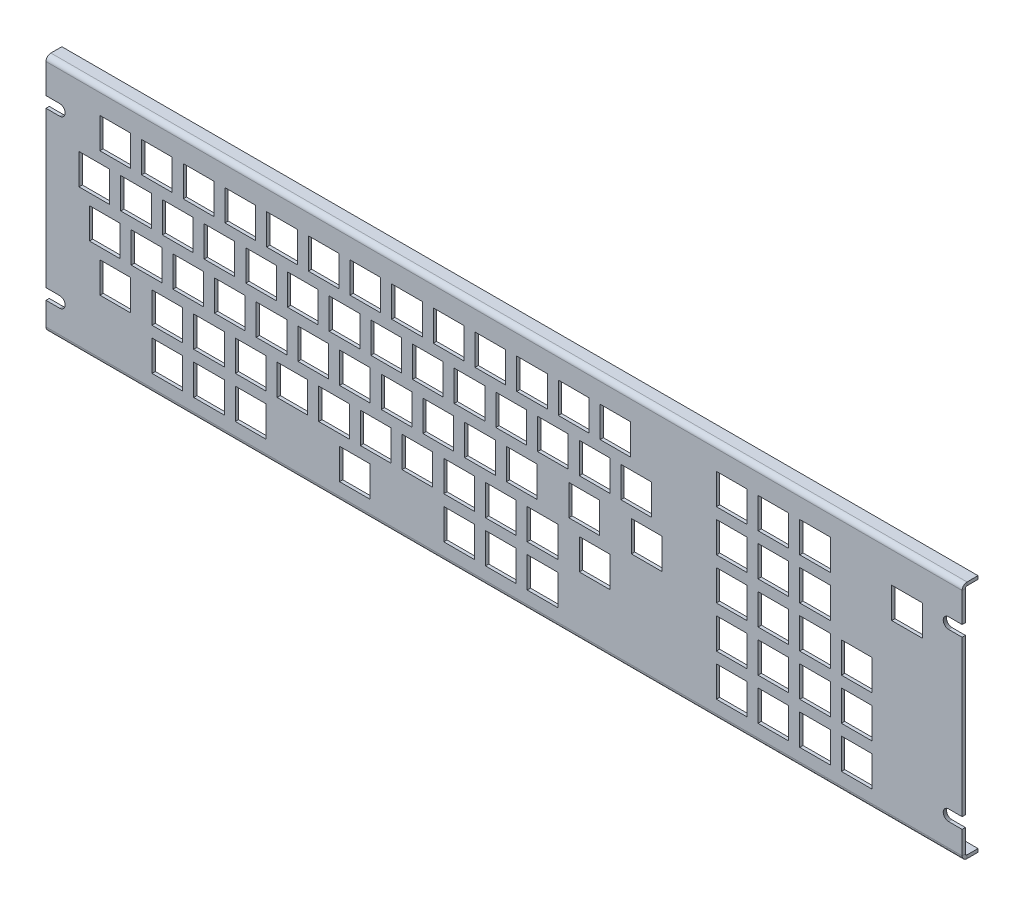
from build123d import *

# Parameters (mm, degrees)
MODEL_R                = 2
MODEL_W                = 14
MODEL_H                = 14
BASE_FLANGE1_DEPTH     = 1.5
SKETCHED_START         = -13.87500635
SKETCHED_BEND1_DEPTH   = 418.67500635
SKETCHED_BEND1_2_DEPTH = 418.67500635
SKETCH12_R             = 2
BOSS_EXTRUDE4_DEPTH    = 1.5
SKETCH14_W             = 14
SKETCH14_H             = 14
CUT_EXTRUDE2_DEPTH     = 422.757241927


# Read off the part's stored shape, not the designer's step: Sketched Bend1
# Sheet-metal steps are written as plain solids
with BuildPart() as part:
    # Model → Base-Flange1 (new body)
    with BuildSketch(Plane.XY):
        Polygon((404.8, -10), (404.8, -24.5), (398.662814326, -24.5), (398.591424199, -24.501019518), (398.520092298, -24.50407724), (398.448876804, -24.509170673), (398.377835801, -24.516295662), (398.30702723, -24.525446395), (398.236508844, -24.53661541), (398.166338159, -24.549793597), (398.096572407, -24.564970208), (398.02726849, -24.582132863), (397.958482934, -24.601267566), (397.89027184, -24.622358709), (397.822690843, -24.645389091), (397.755795062, -24.670339927), (397.68963906, -24.697190867), (397.624276793, -24.725920012), (397.559761573, -24.756503928), (397.496146018, -24.788917673), (397.433482014, -24.823134807), (397.371820672, -24.859127424), (397.311212282, -24.896866168), (397.251706278, -24.936320258), (397.193351195, -24.977457514), (397.136194627, -25.020244385), (397.080283191, -25.064645973), (397.025662491, -25.110626064), (396.972377075, -25.158147155), (396.920470404, -25.207170488), (396.869984814, -25.257656078), (396.820961481, -25.309562749), (396.77344039, -25.362848165), (396.727460299, -25.417468865), (396.683058711, -25.473380301), (396.64027184, -25.530536869), (396.599134583, -25.588891953), (396.559680494, -25.648397956), (396.52194175, -25.709006346), (396.485949133, -25.770667688), (396.451731998, -25.833331692), (396.419318254, -25.896947247), (396.388734337, -25.961462467), (396.360005193, -26.026824734), (396.333154253, -26.092980737), (396.308203417, -26.159876517), (396.285173035, -26.227457514), (396.264081892, -26.295668608), (396.244947189, -26.364454165), (396.227784533, -26.433758081), (396.212607923, -26.503523833), (396.199429736, -26.573694518), (396.188260721, -26.644212904), (396.179109987, -26.715021475), (396.171984998, -26.786062479), (396.166891566, -26.857277973), (396.163833844, -26.928609873), (396.162814326, -27), (396.163833844, -27.071390127), (396.166891566, -27.142722027), (396.171984998, -27.213937521), (396.179109987, -27.284978525), (396.188260721, -27.355787096), (396.199429736, -27.426305482), (396.212607923, -27.496476167), (396.227784533, -27.566241919), (396.244947189, -27.635545835), (396.264081892, -27.704331392), (396.285173035, -27.772542486), (396.308203417, -27.840123483), (396.333154253, -27.907019263), (396.360005193, -27.973175266), (396.388734337, -28.038537533), (396.419318254, -28.103052753), (396.451731998, -28.166668308), (396.485949133, -28.229332312), (396.52194175, -28.290993654), (396.559680494, -28.351602044), (396.599134583, -28.411108047), (396.64027184, -28.469463131), (396.683058711, -28.526619699), (396.727460299, -28.582531135), (396.77344039, -28.637151835), (396.820961481, -28.690437251), (396.869984814, -28.742343922), (396.920470404, -28.792829512), (396.972377075, -28.841852845), (397.025662491, -28.889373936), (397.080283191, -28.935354027), (397.136194627, -28.979755615), (397.193351195, -29.022542486), (397.251706278, -29.063679742), (397.311212282, -29.103133832), (397.371820672, -29.140872576), (397.433482014, -29.176865193), (397.496146018, -29.211082327), (397.559761573, -29.243496072), (397.624276793, -29.274079988), (397.68963906, -29.302809133), (397.755795062, -29.329660073), (397.822690843, -29.354610909), (397.89027184, -29.377641291), (397.958482934, -29.398732434), (398.02726849, -29.417867137), (398.096572407, -29.435029792), (398.166338159, -29.450206403), (398.236508844, -29.46338459), (398.30702723, -29.474553605), (398.377835801, -29.483704338), (398.448876804, -29.490829327), (398.520092298, -29.49592276), (398.591424199, -29.498980482), (398.662814326, -29.5), (404.8, -29.5), (404.8, -100.55), (398.662814326, -100.55), (398.591424195, -100.551019513), (398.520092291, -100.55407723), (398.448876794, -100.559170658), (398.377835786, -100.566295642), (398.307027211, -100.575446371), (398.236508821, -100.586615382), (398.166338132, -100.599793565), (398.096572376, -100.614970171), (398.027268454, -100.632132823), (397.958482893, -100.651267523), (397.890271795, -100.672358663), (397.822690793, -100.695389042), (397.755795008, -100.720339875), (397.689639001, -100.747190813), (397.62427673, -100.775919955), (397.559761504, -100.80650387), (397.496145945, -100.838917612), (397.433481936, -100.873134745), (397.371820589, -100.909127361), (397.311212195, -100.946866103), (397.251706187, -100.986320192), (397.193351099, -101.027457448), (397.136194526, -101.070244319), (397.080283086, -101.114645906), (397.025662381, -101.160625997), (396.97237696, -101.208147088), (396.920470285, -101.257170422), (396.869984691, -101.307656012), (396.820961354, -101.359562684), (396.773440258, -101.412848101), (396.727460163, -101.467468802), (396.683058571, -101.523380239), (396.640271696, -101.580536808), (396.599134436, -101.638891894), (396.559680343, -101.698397899), (396.521941596, -101.75900629), (396.485948976, -101.820667635), (396.451731838, -101.883331641), (396.419318091, -101.946947198), (396.388734171, -102.011462421), (396.360005024, -102.07682469), (396.333154081, -102.142980695), (396.308203243, -102.209876478), (396.285172859, -102.277457478), (396.264081714, -102.345668575), (396.244947009, -102.414454135), (396.227784352, -102.483758055), (396.21260774, -102.55352381), (396.199429552, -102.623694498), (396.188260536, -102.694212887), (396.179109801, -102.765021462), (396.171984812, -102.836062468), (396.166891379, -102.907277966), (396.163833656, -102.978609869), (396.162814138, -103.05), (396.163833656, -103.12139013), (396.166891379, -103.192722034), (396.171984812, -103.263937531), (396.179109801, -103.334978538), (396.188260536, -103.405787112), (396.199429552, -103.476305501), (396.21260774, -103.54647619), (396.227784352, -103.616241945), (396.244947009, -103.685545865), (396.264081714, -103.754331425), (396.285172859, -103.822542521), (396.308203243, -103.890123521), (396.333154081, -103.957019304), (396.360005024, -104.023175309), (396.388734171, -104.088537579), (396.41931809, -104.153052802), (396.451731838, -104.216668359), (396.485948975, -104.279332365), (396.521941596, -104.340993709), (396.559680343, -104.401602101), (396.599134436, -104.461108106), (396.640271696, -104.519463191), (396.683058571, -104.576619761), (396.727460163, -104.632531198), (396.773440258, -104.687151899), (396.820961353, -104.740437316), (396.86998469, -104.792343987), (396.920470285, -104.842829578), (396.97237696, -104.891852911), (397.02566238, -104.939374003), (397.080283085, -104.985354093), (397.136194525, -105.029755681), (397.193351098, -105.072542552), (397.251706186, -105.113679808), (397.311212195, -105.153133896), (397.371820589, -105.190872639), (397.433481936, -105.226865255), (397.496145944, -105.261082388), (397.559761504, -105.29349613), (397.624276729, -105.324080045), (397.689639001, -105.352809187), (397.755795008, -105.379660125), (397.822690793, -105.404610958), (397.890271794, -105.427641337), (397.958482893, -105.448732477), (398.027268454, -105.467867176), (398.096572375, -105.485029829), (398.166338131, -105.500206435), (398.236508821, -105.513384618), (398.307027211, -105.524553629), (398.377835786, -105.533704358), (398.448876793, -105.540829342), (398.520092291, -105.54592277), (398.591424195, -105.548980487), (398.662814325, -105.55), (404.8, -105.55), (404.8, -117), (404.8, -122.42), (-13.87500635, -122.42), (-13.87500635, -117), (-13.87500635, -105.5), (-7.629032258, -105.5), (-7.557642128, -105.498980487), (-7.486310224, -105.49592277), (-7.415094726, -105.490829342), (-7.344053719, -105.483704358), (-7.273245144, -105.474553629), (-7.202726754, -105.463384618), (-7.132556064, -105.450206435), (-7.062790308, -105.435029829), (-6.993486387, -105.417867177), (-6.924700826, -105.398732477), (-6.856489727, -105.377641337), (-6.788908726, -105.354610958), (-6.722012941, -105.329660125), (-6.655856934, -105.302809187), (-6.590494662, -105.274080045), (-6.525979437, -105.24349613), (-6.462363877, -105.211082388), (-6.399699869, -105.176865255), (-6.338038522, -105.140872639), (-6.277430127, -105.103133897), (-6.217924119, -105.063679808), (-6.159569031, -105.022542552), (-6.102412458, -104.979755681), (-6.046501018, -104.935354094), (-5.991880313, -104.889374003), (-5.938594893, -104.841852912), (-5.886688218, -104.792829578), (-5.836202623, -104.742343988), (-5.787179286, -104.690437316), (-5.739658191, -104.637151899), (-5.693678096, -104.582531198), (-5.649276504, -104.526619761), (-5.606489629, -104.469463192), (-5.565352369, -104.411108106), (-5.525898275, -104.351602101), (-5.488159529, -104.29099371), (-5.452166908, -104.229332365), (-5.41794977, -104.166668359), (-5.385536023, -104.103052802), (-5.354952104, -104.038537579), (-5.326222956, -103.97317531), (-5.299372014, -103.907019305), (-5.274421175, -103.840123522), (-5.251390792, -103.772542522), (-5.230299646, -103.704331425), (-5.211164942, -103.635545865), (-5.194002284, -103.566241945), (-5.178825673, -103.49647619), (-5.165647485, -103.426305502), (-5.154478468, -103.355787113), (-5.145327734, -103.284978538), (-5.138202744, -103.213937532), (-5.133109311, -103.142722034), (-5.130051589, -103.071390131), (-5.129032071, -103), (-5.130051589, -102.92860987), (-5.133109311, -102.857277966), (-5.138202744, -102.786062469), (-5.145327734, -102.715021462), (-5.154478468, -102.644212888), (-5.165647484, -102.573694499), (-5.178825673, -102.50352381), (-5.194002284, -102.433758055), (-5.211164942, -102.364454135), (-5.230299646, -102.295668575), (-5.251390791, -102.227457479), (-5.274421175, -102.159876479), (-5.299372014, -102.092980696), (-5.326222956, -102.026824691), (-5.354952103, -101.961462421), (-5.385536023, -101.896947198), (-5.41794977, -101.833331641), (-5.452166908, -101.770667635), (-5.488159528, -101.709006291), (-5.525898275, -101.648397899), (-5.565352368, -101.588891894), (-5.606489629, -101.530536809), (-5.649276503, -101.473380239), (-5.693678096, -101.417468802), (-5.73965819, -101.362848101), (-5.787179286, -101.309562684), (-5.836202623, -101.257656013), (-5.886688217, -101.207170422), (-5.938594892, -101.158147089), (-5.991880313, -101.110625997), (-6.046501018, -101.064645907), (-6.102412458, -101.020244319), (-6.159569031, -100.977457448), (-6.217924119, -100.936320192), (-6.277430127, -100.896866104), (-6.338038521, -100.859127361), (-6.399699868, -100.823134745), (-6.462363877, -100.788917612), (-6.525979436, -100.75650387), (-6.590494662, -100.725919955), (-6.655856933, -100.697190813), (-6.72201294, -100.670339875), (-6.788908725, -100.645389042), (-6.856489727, -100.622358663), (-6.924700825, -100.601267523), (-6.993486386, -100.582132824), (-7.062790308, -100.564970171), (-7.132556064, -100.549793565), (-7.202726753, -100.536615382), (-7.273245143, -100.525446371), (-7.344053718, -100.516295642), (-7.415094726, -100.509170658), (-7.486310223, -100.50407723), (-7.557642127, -100.501019513), (-7.629032258, -100.5), (-13.87500635, -100.5), (-13.87500635, -29.5), (-7.629032258, -29.5), (-7.557642131, -29.498980482), (-7.486310231, -29.49592276), (-7.415094737, -29.490829327), (-7.344053733, -29.483704338), (-7.273245162, -29.474553605), (-7.202726776, -29.46338459), (-7.132556091, -29.450206403), (-7.06279034, -29.435029792), (-6.993486423, -29.417867137), (-6.924700866, -29.398732434), (-6.856489772, -29.377641291), (-6.788908775, -29.354610909), (-6.722012995, -29.329660073), (-6.655856992, -29.302809133), (-6.590494726, -29.274079988), (-6.525979505, -29.243496072), (-6.46236395, -29.211082327), (-6.399699946, -29.176865193), (-6.338038604, -29.140872576), (-6.277430214, -29.103133832), (-6.217924211, -29.063679742), (-6.159569127, -29.022542486), (-6.102412559, -28.979755615), (-6.046501124, -28.935354027), (-5.991880423, -28.889373936), (-5.938595007, -28.841852845), (-5.886688336, -28.792829512), (-5.836202746, -28.742343922), (-5.787179413, -28.690437251), (-5.739658322, -28.637151835), (-5.693678231, -28.582531135), (-5.649276643, -28.526619699), (-5.606489772, -28.469463131), (-5.565352516, -28.411108047), (-5.525898426, -28.351602044), (-5.488159682, -28.290993654), (-5.452167065, -28.229332312), (-5.417949931, -28.166668308), (-5.385536186, -28.103052753), (-5.35495227, -28.038537533), (-5.326223125, -27.973175266), (-5.299372185, -27.907019263), (-5.274421349, -27.840123483), (-5.251390967, -27.772542486), (-5.230299824, -27.704331392), (-5.211165121, -27.635545835), (-5.194002466, -27.566241919), (-5.178825855, -27.496476167), (-5.165647668, -27.426305482), (-5.154478653, -27.355787096), (-5.14532792, -27.284978525), (-5.138202931, -27.213937521), (-5.133109498, -27.142722027), (-5.130051776, -27.071390127), (-5.129032258, -27), (-5.130051776, -26.928609873), (-5.133109498, -26.857277973), (-5.138202931, -26.786062479), (-5.14532792, -26.715021475), (-5.154478653, -26.644212904), (-5.165647668, -26.573694518), (-5.178825855, -26.503523833), (-5.194002466, -26.433758081), (-5.211165121, -26.364454165), (-5.230299824, -26.295668608), (-5.251390967, -26.227457514), (-5.274421349, -26.159876517), (-5.299372185, -26.092980737), (-5.326223125, -26.026824734), (-5.35495227, -25.961462467), (-5.385536186, -25.896947247), (-5.417949931, -25.833331692), (-5.452167065, -25.770667688), (-5.488159682, -25.709006346), (-5.525898426, -25.648397956), (-5.565352516, -25.588891953), (-5.606489772, -25.530536869), (-5.649276643, -25.473380301), (-5.693678231, -25.417468865), (-5.739658322, -25.362848165), (-5.787179413, -25.309562749), (-5.836202746, -25.257656078), (-5.886688336, -25.207170488), (-5.938595007, -25.158147155), (-5.991880423, -25.110626064), (-6.046501124, -25.064645973), (-6.102412559, -25.020244385), (-6.159569127, -24.977457514), (-6.217924211, -24.936320258), (-6.277430214, -24.896866168), (-6.338038604, -24.859127424), (-6.399699946, -24.823134807), (-6.46236395, -24.788917673), (-6.525979505, -24.756503928), (-6.590494726, -24.725920012), (-6.655856992, -24.697190867), (-6.722012995, -24.670339927), (-6.788908775, -24.645389091), (-6.856489772, -24.622358709), (-6.924700866, -24.601267566), (-6.993486423, -24.582132863), (-7.06279034, -24.564970208), (-7.132556091, -24.549793597), (-7.202726776, -24.53661541), (-7.273245162, -24.525446395), (-7.344053733, -24.516295662), (-7.415094737, -24.509170673), (-7.486310231, -24.50407724), (-7.557642131, -24.501019518), (-7.629032258, -24.5), (-13.87500635, -24.5), (-13.87500635, -10), (-13.87500635, -4.58), (404.8, -4.58), align=None)
        with Locations((5.1501143, -27)):
            Circle(MODEL_R, mode=Mode.SUBTRACT)
        with Locations((5.1501143, -103.0500381)):
            Circle(MODEL_R, mode=Mode.SUBTRACT)
        with Locations((380, -103.1998984)):
            Circle(MODEL_R, mode=Mode.SUBTRACT)
        with Locations((84.42494285, -16.764008128)):
            Circle(MODEL_R, mode=Mode.SUBTRACT)
        with Locations((160.62509525, -16.764008128)):
            Circle(MODEL_R, mode=Mode.SUBTRACT)
        with Locations((217.77495555, -16.764008128)):
            Circle(MODEL_R, mode=Mode.SUBTRACT)
        with Locations((98.712979426, -98)):
            Circle(MODEL_R, mode=Mode.SUBTRACT)
        with Locations((155.863093726, -98)):
            Circle(MODEL_R, mode=Mode.SUBTRACT)
        with Locations((236.822961646, -103.2)):
            Circle(MODEL_R, mode=Mode.SUBTRACT)
        with Locations((285.737998476, -103.1998984)):
            Circle(MODEL_R, mode=Mode.SUBTRACT)
        with Locations((285.737998476, -65.1000762)):
            Circle(MODEL_R, mode=Mode.SUBTRACT)
        with Locations((285.737998476, -26.7500635)):
            Circle(MODEL_R, mode=Mode.SUBTRACT)
        with Locations((380, -18.500127)):
            Circle(MODEL_R, mode=Mode.SUBTRACT)
        with Locations((380, -45.500127)):
            Circle(MODEL_R, mode=Mode.SUBTRACT)
        with Locations((55.85, -27)):
            Rectangle(MODEL_W, MODEL_H, mode=Mode.SUBTRACT)
        with Locations((17.75, -27)):
            Rectangle(MODEL_W, MODEL_H, mode=Mode.SUBTRACT)
        with Locations((36.8, -27)):
            Rectangle(MODEL_W, MODEL_H, mode=Mode.SUBTRACT)
        with Locations((74.9000508, -27)):
            Rectangle(MODEL_W, MODEL_H, mode=Mode.SUBTRACT)
        with Locations((93.9500889, -27)):
            Rectangle(MODEL_W, MODEL_H, mode=Mode.SUBTRACT)
        with Locations((113.000127, -27)):
            Rectangle(MODEL_W, MODEL_H, mode=Mode.SUBTRACT)
        with Locations((132.0499111, -27)):
            Rectangle(MODEL_W, MODEL_H, mode=Mode.SUBTRACT)
        with Locations((151.0999492, -27)):
            Rectangle(MODEL_W, MODEL_H, mode=Mode.SUBTRACT)
        with Locations((170.1499873, -27)):
            Rectangle(MODEL_W, MODEL_H, mode=Mode.SUBTRACT)
        with Locations((189.2000254, -27)):
            Rectangle(MODEL_W, MODEL_H, mode=Mode.SUBTRACT)
        with Locations((208.2500635, -27)):
            Rectangle(MODEL_W, MODEL_H, mode=Mode.SUBTRACT)
        with Locations((227.3001016, -27)):
            Rectangle(MODEL_W, MODEL_H, mode=Mode.SUBTRACT)
        with Locations((246.3501397, -27)):
            Rectangle(MODEL_W, MODEL_H, mode=Mode.SUBTRACT)
        with Locations((299.488061976, -27)):
            Rectangle(MODEL_W, MODEL_H, mode=Mode.SUBTRACT)
        with Locations((299.488061976, -46.0497841)):
            Rectangle(MODEL_W, MODEL_H, mode=Mode.SUBTRACT)
        with Locations((255.87490475, -46.0497841)):
            Rectangle(MODEL_W, MODEL_H, mode=Mode.SUBTRACT)
        with Locations((236.82512065, -46.0497841)):
            Rectangle(MODEL_W, MODEL_H, mode=Mode.SUBTRACT)
        with Locations((217.77508255, -46.0497841)):
            Rectangle(MODEL_W, MODEL_H, mode=Mode.SUBTRACT)
        with Locations((198.72504445, -46.0497841)):
            Rectangle(MODEL_W, MODEL_H, mode=Mode.SUBTRACT)
        with Locations((318.538100076, -27)):
            Rectangle(MODEL_W, MODEL_H, mode=Mode.SUBTRACT)
        with Locations((337.588138176, -27)):
            Rectangle(MODEL_W, MODEL_H, mode=Mode.SUBTRACT)
        with Locations((318.538100076, -46.0497841)):
            Rectangle(MODEL_W, MODEL_H, mode=Mode.SUBTRACT)
        with Locations((337.588138176, -46.0497841)):
            Rectangle(MODEL_W, MODEL_H, mode=Mode.SUBTRACT)
        with Locations((299.488315977, -65.1000762)):
            Rectangle(MODEL_W, MODEL_H, mode=Mode.SUBTRACT)
        with Locations((318.538100076, -65.1000762)):
            Rectangle(MODEL_W, MODEL_H, mode=Mode.SUBTRACT)
        with Locations((337.588138176, -65.1000762)):
            Rectangle(MODEL_W, MODEL_H, mode=Mode.SUBTRACT)
        with Locations((299.488061976, -84.1498603)):
            Rectangle(MODEL_W, MODEL_H, mode=Mode.SUBTRACT)
        with Locations((318.538100076, -84.1498603)):
            Rectangle(MODEL_W, MODEL_H, mode=Mode.SUBTRACT)
        with Locations((337.588138176, -84.1498603)):
            Rectangle(MODEL_W, MODEL_H, mode=Mode.SUBTRACT)
        with Locations((337.588900178, -103.199136398)):
            Rectangle(MODEL_W, MODEL_H, mode=Mode.SUBTRACT)
        with Locations((318.538100076, -103.1998984)):
            Rectangle(MODEL_W, MODEL_H, mode=Mode.SUBTRACT)
        with Locations((299.488061976, -103.1998984)):
            Rectangle(MODEL_W, MODEL_H, mode=Mode.SUBTRACT)
        with Locations((260.638430277, -65.099568199)):
            Rectangle(MODEL_W, MODEL_H, mode=Mode.SUBTRACT)
        with Locations((236.82512065, -84.1498603)):
            Rectangle(MODEL_W, MODEL_H, mode=Mode.SUBTRACT)
        with Locations((379.598806198, -31.999237998)):
            Rectangle(MODEL_W, MODEL_H, mode=Mode.SUBTRACT)
        with Locations((213.013081026, -84.1498603)):
            Rectangle(MODEL_W, MODEL_H, mode=Mode.SUBTRACT)
        with Locations((203.488061976, -65.1000762)):
            Rectangle(MODEL_W, MODEL_H, mode=Mode.SUBTRACT)
        with Locations((213.013081026, -103.1998984)):
            Rectangle(MODEL_W, MODEL_H, mode=Mode.SUBTRACT)
        with Locations((193.963296927, -103.2001524)):
            Rectangle(MODEL_W, MODEL_H, mode=Mode.SUBTRACT)
        with Locations((193.963042926, -84.1498603)):
            Rectangle(MODEL_W, MODEL_H, mode=Mode.SUBTRACT)
        with Locations((174.913004826, -84.1498603)):
            Rectangle(MODEL_W, MODEL_H, mode=Mode.SUBTRACT)
        with Locations((184.438023876, -65.0998222)):
            Rectangle(MODEL_W, MODEL_H, mode=Mode.SUBTRACT)
        with Locations((179.67500635, -46.0497841)):
            Rectangle(MODEL_W, MODEL_H, mode=Mode.SUBTRACT)
        with Locations((160.62496825, -46.0497841)):
            Rectangle(MODEL_W, MODEL_H, mode=Mode.SUBTRACT)
        with Locations((165.387985776, -65.0998222)):
            Rectangle(MODEL_W, MODEL_H, mode=Mode.SUBTRACT)
        with Locations((141.57493015, -46.0497841)):
            Rectangle(MODEL_W, MODEL_H, mode=Mode.SUBTRACT)
        with Locations((146.337947676, -65.0998222)):
            Rectangle(MODEL_W, MODEL_H, mode=Mode.SUBTRACT)
        with Locations((155.862966726, -84.1498603)):
            Rectangle(MODEL_W, MODEL_H, mode=Mode.SUBTRACT)
        with Locations((8.22491745, -46.0497841)):
            Rectangle(MODEL_W, MODEL_H, mode=Mode.SUBTRACT)
        with Locations((27.27495555, -46.0497841)):
            Rectangle(MODEL_W, MODEL_H, mode=Mode.SUBTRACT)
        with Locations((46.32499365, -46.0497841)):
            Rectangle(MODEL_W, MODEL_H, mode=Mode.SUBTRACT)
        with Locations((65.37503175, -46.0497841)):
            Rectangle(MODEL_W, MODEL_H, mode=Mode.SUBTRACT)
        with Locations((84.42506985, -46.0497841)):
            Rectangle(MODEL_W, MODEL_H, mode=Mode.SUBTRACT)
        with Locations((103.47510795, -46.0497841)):
            Rectangle(MODEL_W, MODEL_H, mode=Mode.SUBTRACT)
        with Locations((122.52489205, -46.0497841)):
            Rectangle(MODEL_W, MODEL_H, mode=Mode.SUBTRACT)
        with Locations((127.287909576, -65.0998222)):
            Rectangle(MODEL_W, MODEL_H, mode=Mode.SUBTRACT)
        with Locations((136.812928626, -84.1498603)):
            Rectangle(MODEL_W, MODEL_H, mode=Mode.SUBTRACT)
        with Locations((108.238125476, -65.0998222)):
            Rectangle(MODEL_W, MODEL_H, mode=Mode.SUBTRACT)
        with Locations((89.188087376, -65.0998222)):
            Rectangle(MODEL_W, MODEL_H, mode=Mode.SUBTRACT)
        with Locations((70.138049276, -65.1000762)):
            Rectangle(MODEL_W, MODEL_H, mode=Mode.SUBTRACT)
        with Locations((51.088011176, -65.1000762)):
            Rectangle(MODEL_W, MODEL_H, mode=Mode.SUBTRACT)
        with Locations((32.037973076, -65.1000762)):
            Rectangle(MODEL_W, MODEL_H, mode=Mode.SUBTRACT)
        with Locations((12.987934976, -65.0998222)):
            Rectangle(MODEL_W, MODEL_H, mode=Mode.SUBTRACT)
        with Locations((17.7499365, -84.1498603)):
            Rectangle(MODEL_W, MODEL_H, mode=Mode.SUBTRACT)
        with Locations((41.562992126, -84.1498603)):
            Rectangle(MODEL_W, MODEL_H, mode=Mode.SUBTRACT)
        with Locations((60.613030226, -84.1498603)):
            Rectangle(MODEL_W, MODEL_H, mode=Mode.SUBTRACT)
        with Locations((79.663068326, -84.1498603)):
            Rectangle(MODEL_W, MODEL_H, mode=Mode.SUBTRACT)
        with Locations((98.713106426, -84.1498603)):
            Rectangle(MODEL_W, MODEL_H, mode=Mode.SUBTRACT)
        with Locations((117.763144526, -84.1498603)):
            Rectangle(MODEL_W, MODEL_H, mode=Mode.SUBTRACT)
        with Locations((60.613284227, -103.2001524)):
            Rectangle(MODEL_W, MODEL_H, mode=Mode.SUBTRACT)
        with Locations((41.563246126, -103.1998984)):
            Rectangle(MODEL_W, MODEL_H, mode=Mode.SUBTRACT)
        with Locations((356.638176276, -65.0998222)):
            Rectangle(MODEL_W, MODEL_H, mode=Mode.SUBTRACT)
        with Locations((356.638176276, -84.1498603)):
            Rectangle(MODEL_W, MODEL_H, mode=Mode.SUBTRACT)
        with Locations((356.637922276, -103.199644399)):
            Rectangle(MODEL_W, MODEL_H, mode=Mode.SUBTRACT)
        with Locations((232.063373127, -65.099568199)):
            Rectangle(MODEL_W, MODEL_H, mode=Mode.SUBTRACT)
        with Locations((127.287909576, -103.1998984)):
            Rectangle(MODEL_W, MODEL_H, mode=Mode.SUBTRACT)
    extrude(amount=-BASE_FLANGE1_DEPTH)

    # Sketched Bend1 outline → Sketched Bend1 (cut)
    with BuildSketch(Plane.YZ.offset(SKETCHED_START)):
        with BuildLine():
            Line((-122.42, -1.5), (-118.125223856, -1.5))
            ThreePointArc((-118.125223856, -1.5), (-117.308564082, -0.413161062), (-116.0134, 0))
            Line((-116.0134, 0), (-122.42, 0))
            Line((-122.42, 0), (-122.42, -1.5))
        make_face()
        with BuildLine():
            ThreePointArc((-10.9866, 0), (-9.691435918, -0.413161062), (-8.874776144, -1.5))
            Line((-8.874776144, -1.5), (-4.58, -1.5))
            Line((-4.58, -1.5), (-4.58, 0))
            Line((-4.58, 0), (-10.9866, 0))
        make_face()
    extrude(amount=SKETCHED_BEND1_DEPTH, mode=Mode.SUBTRACT)

    # Sketched Bend1 2 outline → Sketched Bend1 2 (add)
    with BuildSketch(Plane.YZ.offset(SKETCHED_START)):
        with BuildLine():
            Line((-116.75, -7.250531977), (-116.75, -2.2366))
            ThreePointArc((-116.75, -2.2366), (-116.534254855, -1.715745145), (-116.0134, -1.5))
            Line((-116.0134, -1.5), (-118.125223856, -1.5))
            ThreePointArc((-118.125223856, -1.5), (-118.218585343, -1.863053267), (-118.25, -2.2366))
            Line((-118.25, -2.2366), (-118.25, -7.250531977))
            Line((-118.25, -7.250531977), (-116.75, -7.250531977))
        make_face()
        with BuildLine():
            Line((-8.874776144, -1.5), (-10.9866, -1.5))
            ThreePointArc((-10.9866, -1.5), (-10.465745145, -1.715745145), (-10.25, -2.2366))
            Line((-10.25, -2.2366), (-10.25, -7.250531977))
            Line((-10.25, -7.250531977), (-8.75, -7.250531977))
            Line((-8.75, -7.250531977), (-8.75, -2.2366))
            ThreePointArc((-8.75, -2.2366), (-8.781414657, -1.863053267), (-8.874776144, -1.5))
        make_face()
    extrude(amount=SKETCHED_BEND1_2_DEPTH)

    # Sketch12 → Boss-Extrude4 (add)
    with BuildSketch(Plane.XY):
        with Locations((5.1501143, -27)):
            Circle(SKETCH12_R)
        with Locations((5.1501143, -103.0500381)):
            Circle(SKETCH12_R)
        with Locations((98.712979426, -98)):
            Circle(SKETCH12_R)
        with Locations((84.42494285, -16.764008128)):
            Circle(SKETCH12_R)
        with Locations((160.62509525, -16.764008128)):
            Circle(SKETCH12_R)
        with Locations((155.863093726, -98)):
            Circle(SKETCH12_R)
        with Locations((217.77495555, -16.764008128)):
            Circle(SKETCH12_R)
        with Locations((236.822961646, -103.2)):
            Circle(SKETCH12_R)
        with Locations((285.737998476, -26.7500635)):
            Circle(SKETCH12_R)
        with Locations((285.737998476, -103.1998984)):
            Circle(SKETCH12_R)
        with Locations((285.737998476, -65.1000762)):
            Circle(SKETCH12_R)
        with Locations((380, -18.500127)):
            Circle(SKETCH12_R)
        with Locations((380, -45.500127)):
            Circle(SKETCH12_R)
        with Locations((380, -103.1998984)):
            Circle(SKETCH12_R)
    extrude(amount=-BOSS_EXTRUDE4_DEPTH)

    # Sketch14 → Cut-Extrude2 (cut, through all)
    with BuildSketch(Plane(origin=(0, 0, -1.5), x_dir=(-1, 0, 0), z_dir=(0, 0, -1))):
        with Locations((-79.663830328, -103.199136398)):
            Rectangle(SKETCH14_W, SKETCH14_H)
        with Locations((-174.914020828, -103.199136398)):
            Rectangle(SKETCH14_W, SKETCH14_H)
    extrude(amount=-CUT_EXTRUDE2_DEPTH, mode=Mode.SUBTRACT)


solid = part.part
